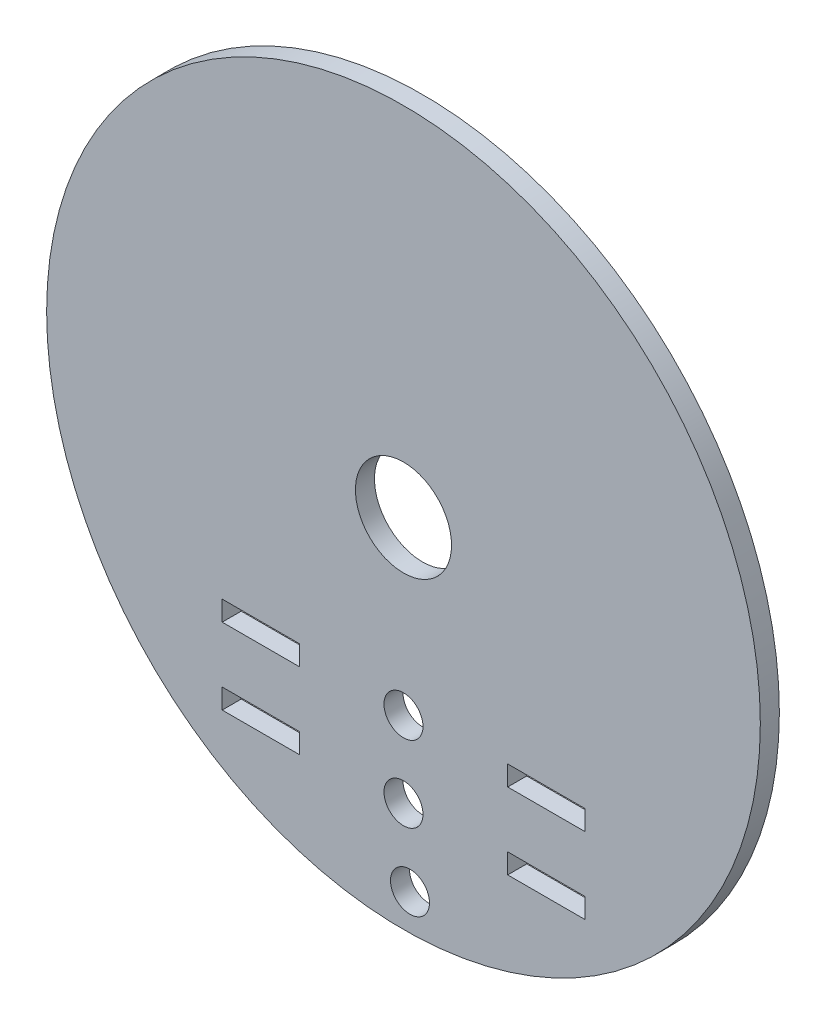
from build123d import *

# Parameters (mm, degrees)
SKETCH_1_R      = 37.5
SKETCH_1_R_2    = 2.05
SKETCH_1_R_3    = 5.05
SKETCH_1_W      = 8.1
SKETCH_1_H      = 2.1
EXTRUDE_1_DEPTH = 2


with BuildPart() as part:
    # 草图1 → 凸台-拉伸1 (new body)
    with BuildSketch(Plane.XY):
        with Locations((0, 26)):
            Circle(SKETCH_1_R)
        Circle(SKETCH_1_R_2, mode=Mode.SUBTRACT)
        with Locations((0, 8)):
            Circle(SKETCH_1_R_2, mode=Mode.SUBTRACT)
        with Locations((0, 26)):
            Circle(SKETCH_1_R_3, mode=Mode.SUBTRACT)
        with Locations((0.683522258, -7.714812291)):
            Circle(SKETCH_1_R_2, mode=Mode.SUBTRACT)
        with Locations((-15, 8)):
            Rectangle(SKETCH_1_W, SKETCH_1_H, mode=Mode.SUBTRACT)
        with Locations((-15, 0)):
            Rectangle(SKETCH_1_W, SKETCH_1_H, mode=Mode.SUBTRACT)
        with Locations((15, 8)):
            Rectangle(SKETCH_1_W, SKETCH_1_H, mode=Mode.SUBTRACT)
        with Locations((15, 0)):
            Rectangle(SKETCH_1_W, SKETCH_1_H, mode=Mode.SUBTRACT)
    extrude(amount=EXTRUDE_1_DEPTH)


solid = part.part
